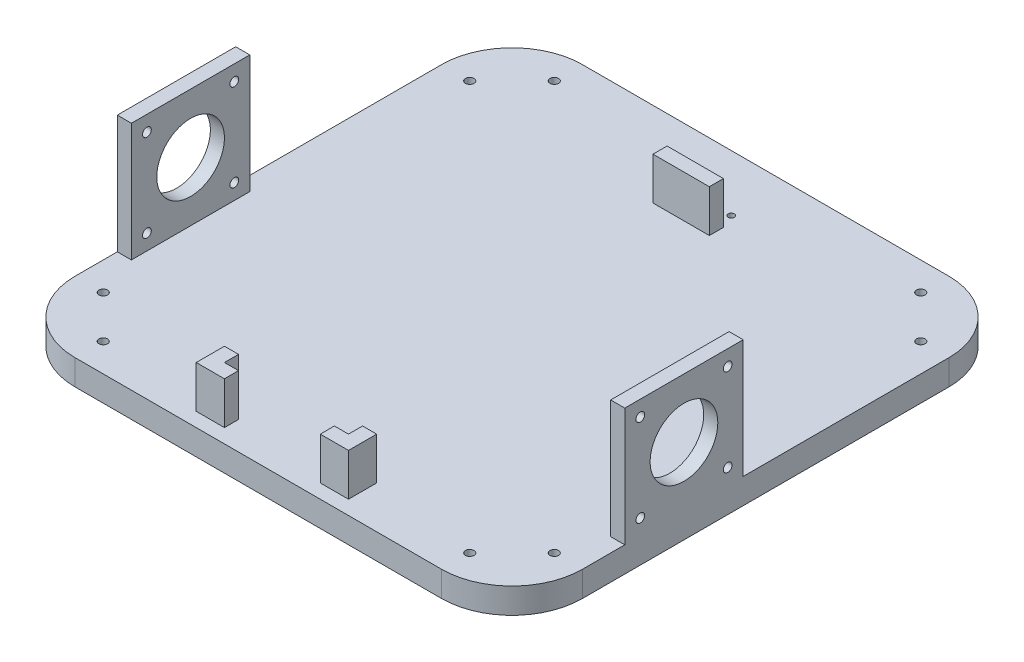
from build123d import *

# Parameters (mm, degrees)
PLATE_DEPTH          = 9
SKETCH2_R            = 1.09
CASTER_HOLES_DEPTH   = 128.597021909
SKETCH3_R            = 1.525
HEX_HOLES_DEPTH      = 128.597021909
SKETCH4_W            = 20
SKETCH4_H            = 5
BATTERY_HOLDER_DEPTH = 15
SKETCH5_W            = 42
SKETCH5_H            = 42
SKETCH5_R            = 12
SKETCH5_R_2          = 1.55
BOSS_EXTRUDE2_DEPTH  = 5
BOSS_EXTRUDE3_START  = -5
SKETCH6_W            = 42
SKETCH6_H            = 42
SKETCH6_R            = 12
SKETCH6_R_2          = 1.55
BOSS_EXTRUDE3_DEPTH  = 5
SKETCH7_R            = 11.6
CUT_EXTRUDE1_DEPTH   = 2


with BuildPart() as part:
    # Sketch1 → Plate (new body)
    with BuildSketch(Plane(origin=(0, 0, 0), x_dir=(1, 0, 0), z_dir=(0, 1, 0))):
        with BuildLine():
            Line((-65, -90), (65, -90))
            ThreePointArc((65, -90), (82.67766953, -82.67766953), (90, -65))
            Line((90, -65), (90, 65))
            ThreePointArc((90, 65), (82.67766953, 82.67766953), (65, 90))
            Line((65, 90), (-65, 90))
            ThreePointArc((-65, 90), (-82.67766953, 82.67766953), (-90, 65))
            Line((-90, 65), (-90, -65))
            ThreePointArc((-90, -65), (-82.67766953, -82.67766953), (-65, -90))
        make_face()
    extrude(amount=PLATE_DEPTH)

    # Sketch2 → Caster Holes (cut, through all)
    with BuildSketch(Plane(origin=(0, 9, 0), x_dir=(1, 0, 0), z_dir=(0, 1, 0))):
        with Locations((-7.747, 70)):
            Circle(SKETCH2_R)
        with Locations((7.747, 70)):
            Circle(SKETCH2_R)
    extrude(amount=-CASTER_HOLES_DEPTH, mode=Mode.SUBTRACT)

    # Sketch3 → Hex Holes (cut, through all)
    with BuildSketch(Plane(origin=(0, 9, 0), x_dir=(1, 0, 0), z_dir=(0, 1, 0))):
        with Locations((-65, 80)):
            Circle(SKETCH3_R)
        with Locations((-80, 65)):
            Circle(SKETCH3_R)
        with Locations((80, 65)):
            Circle(SKETCH3_R)
        with Locations((80, -65)):
            Circle(SKETCH3_R)
        with Locations((65, 80)):
            Circle(SKETCH3_R)
        with Locations((65, -80)):
            Circle(SKETCH3_R)
        with Locations((-65, -80)):
            Circle(SKETCH3_R)
        with Locations((-80, -65)):
            Circle(SKETCH3_R)
    extrude(amount=-HEX_HOLES_DEPTH, mode=Mode.SUBTRACT)

    # Sketch4 → Battery Holder (add)
    with BuildSketch(Plane(origin=(0, 9, 0), x_dir=(1, 0, 0), z_dir=(0, 1, 0))):
        Polygon((-22, -80), (-17, -80), (-17, -85), (-27, -85), (-27, -75), (-22, -75), align=None)
        Polygon((17, -80), (22, -80), (22, -75), (27, -75), (27, -85), (17, -85), align=None)
        with Locations((0, 62.5)):
            Rectangle(SKETCH4_W, SKETCH4_H)
    extrude(amount=BATTERY_HOLDER_DEPTH)

    # Sketch5 → Boss-Extrude2 (add)
    with BuildSketch(Plane.ZY.offset(90)):
        with Locations((29, 30)):
            Rectangle(SKETCH5_W, SKETCH5_H)
        with Locations((29, 30)):
            Circle(SKETCH5_R, mode=Mode.SUBTRACT)
        with Locations((13.5, 45.5)):
            Circle(SKETCH5_R_2, mode=Mode.SUBTRACT)
        with Locations((44.5, 45.5)):
            Circle(SKETCH5_R_2, mode=Mode.SUBTRACT)
        with Locations((44.5, 14.5)):
            Circle(SKETCH5_R_2, mode=Mode.SUBTRACT)
        with Locations((13.5, 14.5)):
            Circle(SKETCH5_R_2, mode=Mode.SUBTRACT)
    extrude(amount=-BOSS_EXTRUDE2_DEPTH)

    # Sketch6 → Boss-Extrude3 (add)
    with BuildSketch(Plane(origin=(90, 0, 0), x_dir=(0, 0, -1), z_dir=(1, 0, 0)).offset(BOSS_EXTRUDE3_START)):
        with Locations((-29, 30)):
            Rectangle(SKETCH6_W, SKETCH6_H)
        with Locations((-29, 30)):
            Circle(SKETCH6_R, mode=Mode.SUBTRACT)
        with Locations((-44.5, 45.5)):
            Circle(SKETCH6_R_2, mode=Mode.SUBTRACT)
        with Locations((-13.5, 45.5)):
            Circle(SKETCH6_R_2, mode=Mode.SUBTRACT)
        with Locations((-13.5, 14.5)):
            Circle(SKETCH6_R_2, mode=Mode.SUBTRACT)
        with Locations((-44.5, 14.5)):
            Circle(SKETCH6_R_2, mode=Mode.SUBTRACT)
    extrude(amount=BOSS_EXTRUDE3_DEPTH)

    # Sketch7 → Cut-Extrude1 (cut)
    with BuildSketch(Plane.XZ):
        with Locations((0, -70)):
            Circle(SKETCH7_R)
    extrude(amount=-CUT_EXTRUDE1_DEPTH, mode=Mode.SUBTRACT)


solid = part.part
